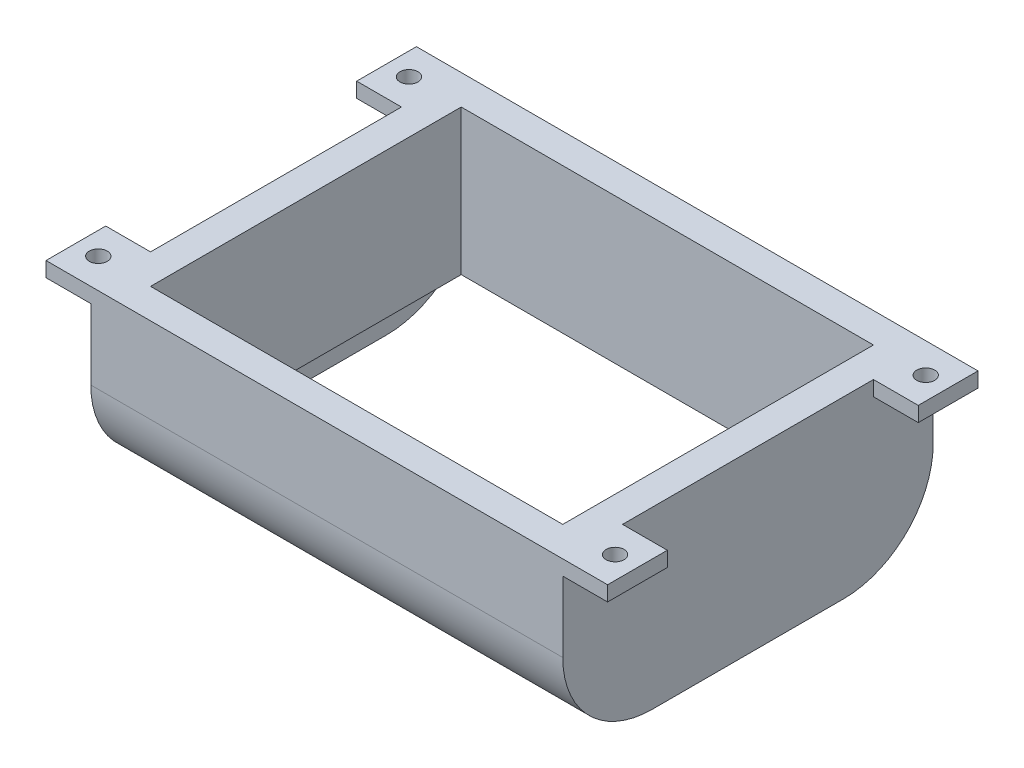
from build123d import *

# Parameters (mm, degrees)
SKETCH1_W                 = 79
SKETCH1_H                 = 62
SKETCH1_W_2               = 69
SKETCH1_H_2               = 52
BOSS_EXTRUDE1_DEPTH       = 24.3
BOSS_EXTRUDE2_START       = -5
BOSS_EXTRUDE2_OUTLINE_W   = 79
BOSS_EXTRUDE2_OUTLINE_H   = 62
BOSS_EXTRUDE2_OUTLINE_W_2 = 74
BOSS_EXTRUDE2_OUTLINE_H_2 = 57
BOSS_EXTRUDE2_DEPTH       = 5
SKETCH3_W                 = 10
SKETCH3_H                 = 2.5
BOSS_EXTRUDE3_DEPTH       = 7.5
CUT_EXTRUDE1_DEPTH        = 63.355753544
CUT_EXTRUDE1_DEPTH_BACK   = 63.355753544
SKETCH4_R                 = 1.5
FILLET1_R                 = 15


# Read off the part's stored shape, not the designer's step: Boss-Extrude2
with BuildPart() as part:
    # Sketch1 → Boss-Extrude1 (new body)
    with BuildSketch(Plane(origin=(0, 0, 0), x_dir=(1, 0, 0), z_dir=(0, 1, 0))):
        Rectangle(SKETCH1_W, SKETCH1_H)
        Rectangle(SKETCH1_W_2, SKETCH1_H_2, mode=Mode.SUBTRACT)
    extrude(amount=BOSS_EXTRUDE1_DEPTH)

    # Boss-Extrude2 outline → Boss-Extrude2 (add)
    with BuildSketch(Plane(origin=(0, 0, 0), x_dir=(1, 0, 0), z_dir=(0, 1, 0)).offset(BOSS_EXTRUDE2_START)):
        Rectangle(BOSS_EXTRUDE2_OUTLINE_W, BOSS_EXTRUDE2_OUTLINE_H)
        Rectangle(BOSS_EXTRUDE2_OUTLINE_W_2, BOSS_EXTRUDE2_OUTLINE_H_2, mode=Mode.SUBTRACT)
    extrude(amount=BOSS_EXTRUDE2_DEPTH)

    # Sketch3 → Boss-Extrude3 (add)
    with BuildSketch(Plane.ZY.offset(39.5)):
        with Locations((-26, 23.05)):
            Rectangle(SKETCH3_W, SKETCH3_H)
        with Locations((26, 23.05)):
            Rectangle(SKETCH3_W, SKETCH3_H)
    boss_extrude3 = extrude(amount=BOSS_EXTRUDE3_DEPTH)

    # Mirror1: Boss-Extrude3 across plane
    add(boss_extrude3.mirror(Plane.ZY))

    # Sketch4 → Cut-Extrude1 (cut, two sides: drawn at the far end of the back side and taken through both)
    with BuildSketch(Plane.XZ.offset(-21.8).offset(-CUT_EXTRUDE1_DEPTH_BACK)):
        with Locations(Location((43.25, 26, 0), (0, 0, 270))):
            Circle(SKETCH4_R)
        with Locations(Location((-43.25, 26, 0), (0, 0, 90))):
            Circle(SKETCH4_R)
        with Locations(Location((-43.25, -26, 0), (0, 0, 270))):
            Circle(SKETCH4_R)
        with Locations(Location((43.25, -26, 0), (0, 0, 270))):
            Circle(SKETCH4_R)
    extrude(amount=CUT_EXTRUDE1_DEPTH + CUT_EXTRUDE1_DEPTH_BACK, mode=Mode.SUBTRACT)

    # Fillet1
    # the kernel refuses this fillet: 15 mm, written as the material it takes off along each edge
    with BuildSketch(Plane(origin=(-77, -5, 31), x_dir=(0, 1, 0), z_dir=(1, 0, 0))) as fillet1_piece_1:
        with BuildLine():
            CenterArc((FILLET1_R, -FILLET1_R), FILLET1_R, 90, 90)
            Line((0, -FILLET1_R), (-FILLET1_R * 0.02, -FILLET1_R))
            Line((-FILLET1_R * 0.02, -FILLET1_R), (-FILLET1_R * 0.02, FILLET1_R * 0.02))
            Line((-FILLET1_R * 0.02, FILLET1_R * 0.02), (FILLET1_R, FILLET1_R * 0.02))
            Line((FILLET1_R, FILLET1_R * 0.02), (FILLET1_R, 0))
        make_face()
    extrude(amount=154, mode=Mode.SUBTRACT)
    # the kernel refuses this fillet: 15 mm, written as the material it takes off along each edge
    with BuildSketch(Plane(origin=(77, -5, -31), x_dir=(0, 1, 0), z_dir=(-1, 0, 0))) as fillet1_2_piece_1:
        with BuildLine():
            CenterArc((FILLET1_R, -FILLET1_R), FILLET1_R, 90, 90)
            Line((0, -FILLET1_R), (-FILLET1_R * 0.02, -FILLET1_R))
            Line((-FILLET1_R * 0.02, -FILLET1_R), (-FILLET1_R * 0.02, FILLET1_R * 0.02))
            Line((-FILLET1_R * 0.02, FILLET1_R * 0.02), (FILLET1_R, FILLET1_R * 0.02))
            Line((FILLET1_R, FILLET1_R * 0.02), (FILLET1_R, 0))
        make_face()
    extrude(amount=154, mode=Mode.SUBTRACT)


solid = part.part
